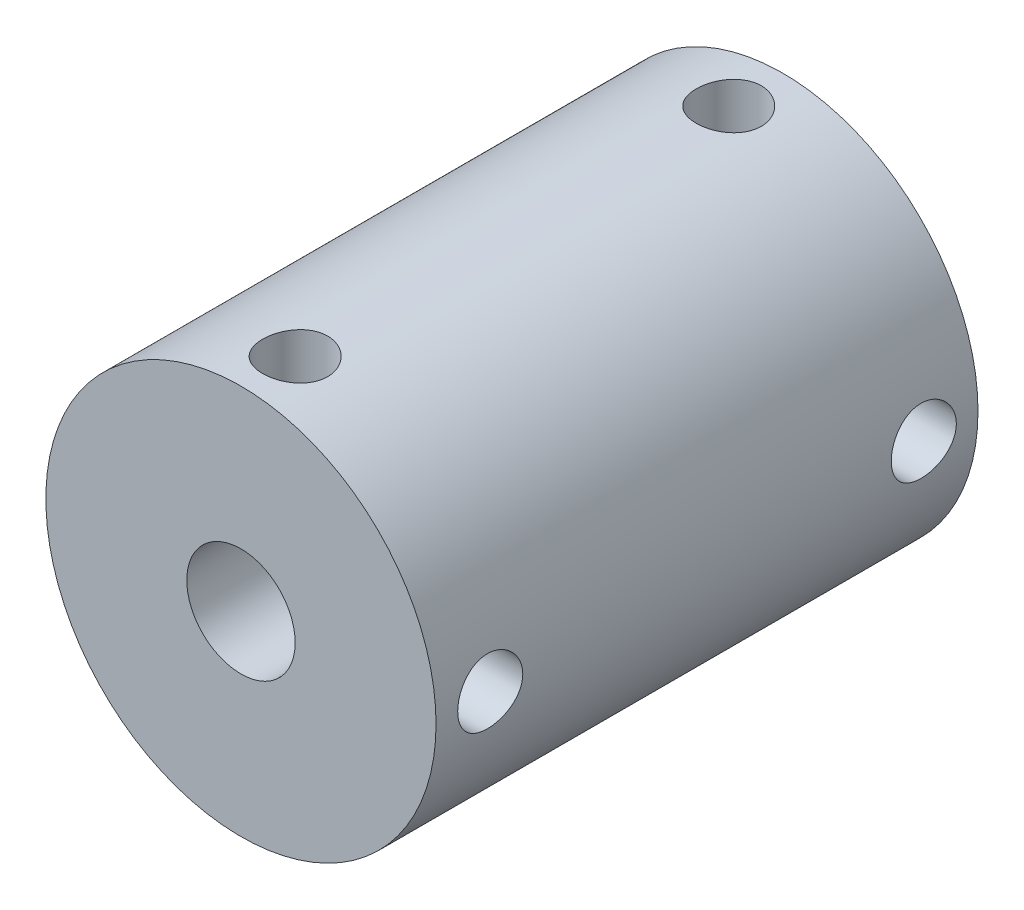
from build123d import *

# Parameters (mm, degrees)
SKETCH1_R           = 9
BOSS_EXTRUDE1_DEPTH = 12.5
SKETCH2_R           = 2.5
CUT_EXTRUDE1_DEPTH  = 29.053520278
SKETCH3_R           = 1.5
CUT_EXTRUDE2_DEPTH  = 18.839562775
SKETCH4_R           = 1.5
CUT_EXTRUDE3_DEPTH  = 18.839562962


with BuildPart() as part:
    # Sketch1 → Boss-Extrude1 (new, symmetric)
    with BuildSketch(Plane.XY):
        Circle(SKETCH1_R)
    extrude(amount=BOSS_EXTRUDE1_DEPTH, both=True)

    # Sketch2 → Cut-Extrude1 (cut, through all)
    with BuildSketch(Plane.XY.offset(12.5)):
        Circle(SKETCH2_R)
    extrude(amount=-CUT_EXTRUDE1_DEPTH, mode=Mode.SUBTRACT)

    # Sketch3 → Cut-Extrude2 (cut, through all)
    with BuildSketch(Plane(origin=(0, 0, 0), x_dir=(1, 0, 0), z_dir=(0, 1, 0))):
        with Locations((0, 10)):
            Circle(SKETCH3_R)
        with Locations((0, -10)):
            Circle(SKETCH3_R)
    extrude(amount=CUT_EXTRUDE2_DEPTH, mode=Mode.SUBTRACT)

    # Sketch4 → Cut-Extrude3 (cut, through all)
    with BuildSketch(Plane(origin=(0, 0, 0), x_dir=(0, 0, -1), z_dir=(1, 0, 0))):
        with Locations((-10, 0)):
            Circle(SKETCH4_R)
        with Locations((10, 0)):
            Circle(SKETCH4_R)
    extrude(amount=CUT_EXTRUDE3_DEPTH, mode=Mode.SUBTRACT)


solid = part.part
